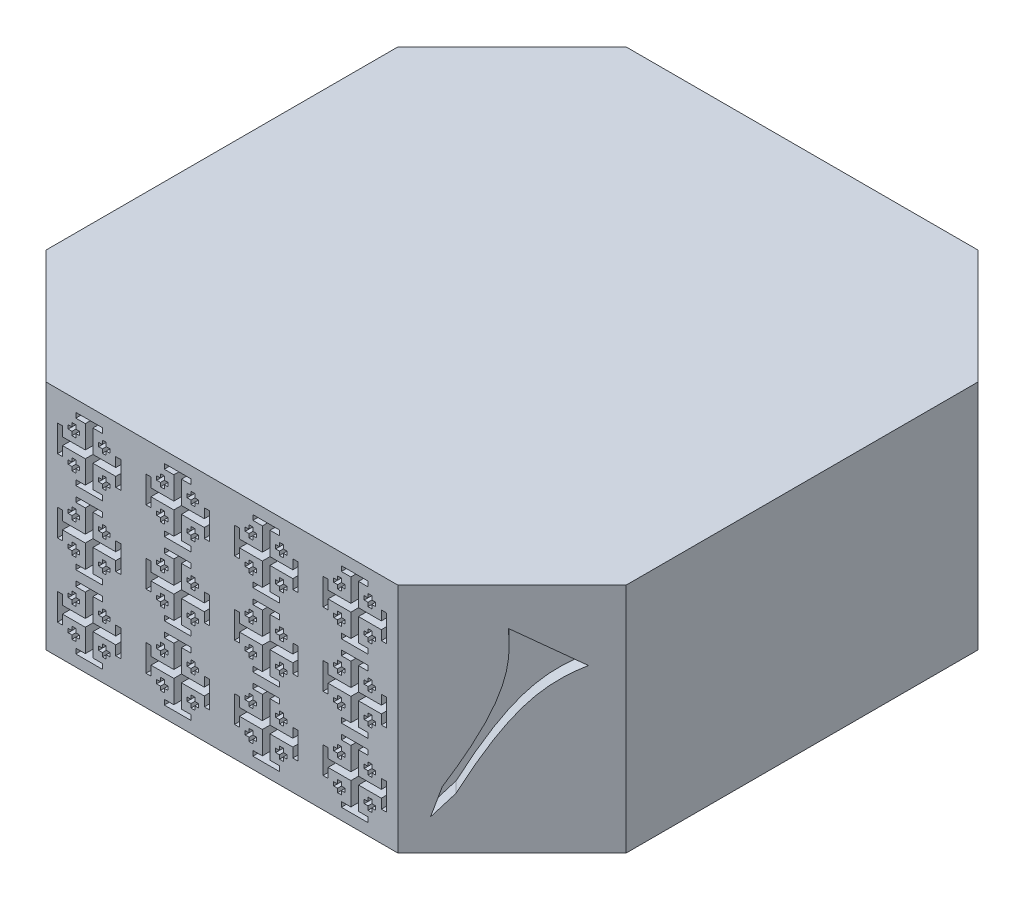
from build123d import *

# Parameters (mm, degrees)
SKETCH1_W           = 38.1
SKETCH1_H           = 38.1
BOSS_EXTRUDE1_DEPTH = 15.24
CUT_EXTRUDE1_DEPTH  = 56.99533552
CUT_EXTRUDE2_DEPTH  = 1
CUT_EXTRUDE3_DEPTH  = 1


with BuildPart() as part:
    # Sketch1 → Boss-Extrude1 (new body)
    with BuildSketch(Plane(origin=(0, 0, 0), x_dir=(1, 0, 0), z_dir=(0, 1, 0))):
        with Locations((19.05, 19.05)):
            Rectangle(SKETCH1_W, SKETCH1_H)
    extrude(amount=BOSS_EXTRUDE1_DEPTH)

    # Sketch2 → Cut-Extrude1 (cut, through all)
    with BuildSketch(Plane(origin=(0, 15.24, 0), x_dir=(1, 0, 0), z_dir=(0, 1, 0))):
        Polygon((30.6, 38.1), (38.1, 30.6), (38.1, 38.1), align=None)
        Polygon((38.1, 0), (38.1, 7.5), (30.6, 0), align=None)
        Polygon((0, 30.6), (7.5, 38.1), (0, 38.1), align=None)
        Polygon((0, 0), (7.5, 0), (0, 7.5), align=None)
    extrude(amount=-CUT_EXTRUDE1_DEPTH, mode=Mode.SUBTRACT)

    # Sketch6 → Cut-Extrude2 (cut)
    with BuildSketch(Plane(origin=(15.3, 0, 15.3), x_dir=(0.7071067811865475, 0, -0.7071067811865477), z_dir=(0.7071067811865477, 0, 0.7071067811865475))):
        with BuildLine():
            Line((24.345514138, 3.403393261), (23.156375891, 2.055676922))
            Line((23.156375891, 2.055676922), (23.701243492, 3.768425706))
            add(Edge.make_bspline(
                [(23.701243492, 3.768425706), (26.718663189, 8.662530398), (26.93497259, 10.625773971), (26.772713928, 12.772598383)],
                knots=[0, 0, 0, 0, 1, 1, 1, 1], degree=3))
            Line((26.772713928, 12.772598383), (30.490582973, 10.666119006))
            add(Edge.make_bspline(
                [(24.345514138, 3.403393261), (26.992755281, 8.507234627), (28.565642017, 9.701865281), (30.490582973, 10.666119006)],
                knots=[0, 0, 0, 0, 1, 1, 1, 1], degree=3))
        make_face()
    extrude(amount=-CUT_EXTRUDE2_DEPTH, mode=Mode.SUBTRACT)

    # Sketch9 → Cut-Extrude3 (cut)
    with BuildSketch(Plane.XY):
        Polygon((9.205, 13.785), (9.205, 13.535), (8.955, 13.535), (8.955, 13.285), (9.205, 13.285), (9.205, 13.035), (9.455, 13.035), (9.455, 13.285), (9.705, 13.285), (9.705, 13.535), (9.455, 13.535), (9.455, 13.785), align=None)
        Polygon((10.33, 14.49), (9.455, 14.49), (9.455, 14.16), (10.08, 14.16), (10.08, 12.66), (8.58, 12.66), (8.58, 13.285), (8.25, 13.285), (8.25, 12.41), (8.25, 11.535), (8.58, 11.535), (8.58, 12.16), (10.08, 12.16), (10.08, 10.66), (9.455, 10.66), (9.455, 10.33), (10.33, 10.33), (11.205, 10.33), (11.205, 10.66), (10.58, 10.66), (10.58, 12.16), (12.08, 12.16), (12.08, 11.535), (12.41, 11.535), (12.41, 12.41), (12.41, 13.285), (12.08, 13.285), (12.08, 12.66), (10.58, 12.66), (10.58, 14.16), (11.205, 14.16), (11.205, 14.49), align=None)
        Polygon((11.705, 13.285), (11.705, 13.535), (11.455, 13.535), (11.455, 13.785), (11.205, 13.785), (11.205, 13.535), (10.955, 13.535), (10.955, 13.285), (11.205, 13.285), (11.205, 13.035), (11.455, 13.035), (11.455, 13.285), align=None)
        Polygon((11.205, 11.035), (11.455, 11.035), (11.455, 11.285), (11.705, 11.285), (11.705, 11.535), (11.455, 11.535), (11.455, 11.785), (11.205, 11.785), (11.205, 11.535), (10.955, 11.535), (10.955, 11.285), (11.205, 11.285), align=None)
        Polygon((8.955, 11.535), (8.955, 11.285), (9.205, 11.285), (9.205, 11.035), (9.455, 11.035), (9.455, 11.285), (9.705, 11.285), (9.705, 11.535), (9.455, 11.535), (9.455, 11.785), (9.205, 11.785), (9.205, 11.535), align=None)
        Polygon((16.143333333, 14.49), (15.268333333, 14.49), (15.268333333, 14.16), (15.893333333, 14.16), (15.893333333, 12.66), (14.393333333, 12.66), (14.393333333, 13.285), (14.063333333, 13.285), (14.063333333, 12.41), (14.063333333, 11.535), (14.393333333, 11.535), (14.393333333, 12.16), (15.893333333, 12.16), (15.893333333, 10.66), (15.268333333, 10.66), (15.268333333, 10.33), (16.143333333, 10.33), (17.018333333, 10.33), (17.018333333, 10.66), (16.393333333, 10.66), (16.393333333, 12.16), (17.893333333, 12.16), (17.893333333, 11.535), (18.223333333, 11.535), (18.223333333, 12.41), (18.223333333, 13.285), (17.893333333, 13.285), (17.893333333, 12.66), (16.393333333, 12.66), (16.393333333, 14.16), (17.018333333, 14.16), (17.018333333, 14.49), align=None)
        Polygon((15.268333333, 13.785), (15.018333333, 13.785), (15.018333333, 13.535), (14.768333333, 13.535), (14.768333333, 13.285), (15.018333333, 13.285), (15.018333333, 13.035), (15.268333333, 13.035), (15.268333333, 13.285), (15.518333333, 13.285), (15.518333333, 13.535), (15.268333333, 13.535), align=None)
        Polygon((14.768333333, 11.535), (14.768333333, 11.285), (15.018333333, 11.285), (15.018333333, 11.035), (15.268333333, 11.035), (15.268333333, 11.285), (15.518333333, 11.285), (15.518333333, 11.535), (15.268333333, 11.535), (15.268333333, 11.785), (15.018333333, 11.785), (15.018333333, 11.535), align=None)
        Polygon((17.018333333, 11.035), (17.268333333, 11.035), (17.268333333, 11.285), (17.518333333, 11.285), (17.518333333, 11.535), (17.268333333, 11.535), (17.268333333, 11.785), (17.018333333, 11.785), (17.018333333, 11.535), (16.768333333, 11.535), (16.768333333, 11.285), (17.018333333, 11.285), align=None)
        Polygon((17.518333333, 13.285), (17.518333333, 13.535), (17.268333333, 13.535), (17.268333333, 13.785), (17.018333333, 13.785), (17.018333333, 13.535), (16.768333333, 13.535), (16.768333333, 13.285), (17.018333333, 13.285), (17.018333333, 13.035), (17.268333333, 13.035), (17.268333333, 13.285), align=None)
        Polygon((21.956666667, 14.49), (21.081666667, 14.49), (21.081666667, 14.16), (21.706666667, 14.16), (21.706666667, 12.66), (20.206666667, 12.66), (20.206666667, 13.285), (19.876666667, 13.285), (19.876666667, 12.41), (19.876666667, 11.535), (20.206666667, 11.535), (20.206666667, 12.16), (21.706666667, 12.16), (21.706666667, 10.66), (21.081666667, 10.66), (21.081666667, 10.33), (21.956666667, 10.33), (22.831666667, 10.33), (22.831666667, 10.66), (22.206666667, 10.66), (22.206666667, 12.16), (23.706666667, 12.16), (23.706666667, 11.535), (24.036666667, 11.535), (24.036666667, 12.41), (24.036666667, 13.285), (23.706666667, 13.285), (23.706666667, 12.66), (22.206666667, 12.66), (22.206666667, 14.16), (22.831666667, 14.16), (22.831666667, 14.49), align=None)
        Polygon((21.081666667, 13.785), (20.831666667, 13.785), (20.831666667, 13.535), (20.581666667, 13.535), (20.581666667, 13.285), (20.831666667, 13.285), (20.831666667, 13.035), (21.081666667, 13.035), (21.081666667, 13.285), (21.331666667, 13.285), (21.331666667, 13.535), (21.081666667, 13.535), align=None)
        Polygon((20.581666667, 11.535), (20.581666667, 11.285), (20.831666667, 11.285), (20.831666667, 11.035), (21.081666667, 11.035), (21.081666667, 11.285), (21.331666667, 11.285), (21.331666667, 11.535), (21.081666667, 11.535), (21.081666667, 11.785), (20.831666667, 11.785), (20.831666667, 11.535), align=None)
        Polygon((22.831666667, 11.035), (23.081666667, 11.035), (23.081666667, 11.285), (23.331666667, 11.285), (23.331666667, 11.535), (23.081666667, 11.535), (23.081666667, 11.785), (22.831666667, 11.785), (22.831666667, 11.535), (22.581666667, 11.535), (22.581666667, 11.285), (22.831666667, 11.285), align=None)
        Polygon((23.331666667, 13.285), (23.331666667, 13.535), (23.081666667, 13.535), (23.081666667, 13.785), (22.831666667, 13.785), (22.831666667, 13.535), (22.581666667, 13.535), (22.581666667, 13.285), (22.831666667, 13.285), (22.831666667, 13.035), (23.081666667, 13.035), (23.081666667, 13.285), align=None)
        Polygon((27.77, 14.49), (26.895, 14.49), (26.895, 14.16), (27.52, 14.16), (27.52, 12.66), (26.02, 12.66), (26.02, 13.285), (25.69, 13.285), (25.69, 12.41), (25.69, 11.535), (26.02, 11.535), (26.02, 12.16), (27.52, 12.16), (27.52, 10.66), (26.895, 10.66), (26.895, 10.33), (27.77, 10.33), (28.645, 10.33), (28.645, 10.66), (28.02, 10.66), (28.02, 12.16), (29.52, 12.16), (29.52, 11.535), (29.85, 11.535), (29.85, 12.41), (29.85, 13.285), (29.52, 13.285), (29.52, 12.66), (28.02, 12.66), (28.02, 14.16), (28.645, 14.16), (28.645, 14.49), align=None)
        Polygon((26.895, 13.785), (26.645, 13.785), (26.645, 13.535), (26.395, 13.535), (26.395, 13.285), (26.645, 13.285), (26.645, 13.035), (26.895, 13.035), (26.895, 13.285), (27.145, 13.285), (27.145, 13.535), (26.895, 13.535), align=None)
        Polygon((26.395, 11.535), (26.395, 11.285), (26.645, 11.285), (26.645, 11.035), (26.895, 11.035), (26.895, 11.285), (27.145, 11.285), (27.145, 11.535), (26.895, 11.535), (26.895, 11.785), (26.645, 11.785), (26.645, 11.535), align=None)
        Polygon((28.645, 11.035), (28.895, 11.035), (28.895, 11.285), (29.145, 11.285), (29.145, 11.535), (28.895, 11.535), (28.895, 11.785), (28.645, 11.785), (28.645, 11.535), (28.395, 11.535), (28.395, 11.285), (28.645, 11.285), align=None)
        Polygon((29.145, 13.285), (29.145, 13.535), (28.895, 13.535), (28.895, 13.785), (28.645, 13.785), (28.645, 13.535), (28.395, 13.535), (28.395, 13.285), (28.645, 13.285), (28.645, 13.035), (28.895, 13.035), (28.895, 13.285), align=None)
        Polygon((16.143333333, 9.7), (15.268333333, 9.7), (15.268333333, 9.37), (15.893333333, 9.37), (15.893333333, 7.87), (14.393333333, 7.87), (14.393333333, 8.495), (14.063333333, 8.495), (14.063333333, 7.62), (14.063333333, 6.745), (14.393333333, 6.745), (14.393333333, 7.37), (15.893333333, 7.37), (15.893333333, 5.87), (15.268333333, 5.87), (15.268333333, 5.54), (16.143333333, 5.54), (17.018333333, 5.54), (17.018333333, 5.87), (16.393333333, 5.87), (16.393333333, 7.37), (17.893333333, 7.37), (17.893333333, 6.745), (18.223333333, 6.745), (18.223333333, 7.62), (18.223333333, 8.495), (17.893333333, 8.495), (17.893333333, 7.87), (16.393333333, 7.87), (16.393333333, 9.37), (17.018333333, 9.37), (17.018333333, 9.7), align=None)
        Polygon((15.268333333, 8.995), (15.018333333, 8.995), (15.018333333, 8.745), (14.768333333, 8.745), (14.768333333, 8.495), (15.018333333, 8.495), (15.018333333, 8.245), (15.268333333, 8.245), (15.268333333, 8.495), (15.518333333, 8.495), (15.518333333, 8.745), (15.268333333, 8.745), align=None)
        Polygon((14.768333333, 6.745), (14.768333333, 6.495), (15.018333333, 6.495), (15.018333333, 6.245), (15.268333333, 6.245), (15.268333333, 6.495), (15.518333333, 6.495), (15.518333333, 6.745), (15.268333333, 6.745), (15.268333333, 6.995), (15.018333333, 6.995), (15.018333333, 6.745), align=None)
        Polygon((17.018333333, 6.245), (17.268333333, 6.245), (17.268333333, 6.495), (17.518333333, 6.495), (17.518333333, 6.745), (17.268333333, 6.745), (17.268333333, 6.995), (17.018333333, 6.995), (17.018333333, 6.745), (16.768333333, 6.745), (16.768333333, 6.495), (17.018333333, 6.495), align=None)
        Polygon((17.518333333, 8.495), (17.518333333, 8.745), (17.268333333, 8.745), (17.268333333, 8.995), (17.018333333, 8.995), (17.018333333, 8.745), (16.768333333, 8.745), (16.768333333, 8.495), (17.018333333, 8.495), (17.018333333, 8.245), (17.268333333, 8.245), (17.268333333, 8.495), align=None)
        Polygon((21.956666667, 9.7), (21.081666667, 9.7), (21.081666667, 9.37), (21.706666667, 9.37), (21.706666667, 7.87), (20.206666667, 7.87), (20.206666667, 8.495), (19.876666667, 8.495), (19.876666667, 7.62), (19.876666667, 6.745), (20.206666667, 6.745), (20.206666667, 7.37), (21.706666667, 7.37), (21.706666667, 5.87), (21.081666667, 5.87), (21.081666667, 5.54), (21.956666667, 5.54), (22.831666667, 5.54), (22.831666667, 5.87), (22.206666667, 5.87), (22.206666667, 7.37), (23.706666667, 7.37), (23.706666667, 6.745), (24.036666667, 6.745), (24.036666667, 7.62), (24.036666667, 8.495), (23.706666667, 8.495), (23.706666667, 7.87), (22.206666667, 7.87), (22.206666667, 9.37), (22.831666667, 9.37), (22.831666667, 9.7), align=None)
        Polygon((21.081666667, 8.995), (20.831666667, 8.995), (20.831666667, 8.745), (20.581666667, 8.745), (20.581666667, 8.495), (20.831666667, 8.495), (20.831666667, 8.245), (21.081666667, 8.245), (21.081666667, 8.495), (21.331666667, 8.495), (21.331666667, 8.745), (21.081666667, 8.745), align=None)
        Polygon((20.581666667, 6.745), (20.581666667, 6.495), (20.831666667, 6.495), (20.831666667, 6.245), (21.081666667, 6.245), (21.081666667, 6.495), (21.331666667, 6.495), (21.331666667, 6.745), (21.081666667, 6.745), (21.081666667, 6.995), (20.831666667, 6.995), (20.831666667, 6.745), align=None)
        Polygon((22.831666667, 6.245), (23.081666667, 6.245), (23.081666667, 6.495), (23.331666667, 6.495), (23.331666667, 6.745), (23.081666667, 6.745), (23.081666667, 6.995), (22.831666667, 6.995), (22.831666667, 6.745), (22.581666667, 6.745), (22.581666667, 6.495), (22.831666667, 6.495), align=None)
        Polygon((23.331666667, 8.495), (23.331666667, 8.745), (23.081666667, 8.745), (23.081666667, 8.995), (22.831666667, 8.995), (22.831666667, 8.745), (22.581666667, 8.745), (22.581666667, 8.495), (22.831666667, 8.495), (22.831666667, 8.245), (23.081666667, 8.245), (23.081666667, 8.495), align=None)
        Polygon((27.77, 9.7), (26.895, 9.7), (26.895, 9.37), (27.52, 9.37), (27.52, 7.87), (26.02, 7.87), (26.02, 8.495), (25.69, 8.495), (25.69, 7.62), (25.69, 6.745), (26.02, 6.745), (26.02, 7.37), (27.52, 7.37), (27.52, 5.87), (26.895, 5.87), (26.895, 5.54), (27.77, 5.54), (28.645, 5.54), (28.645, 5.87), (28.02, 5.87), (28.02, 7.37), (29.52, 7.37), (29.52, 6.745), (29.85, 6.745), (29.85, 7.62), (29.85, 8.495), (29.52, 8.495), (29.52, 7.87), (28.02, 7.87), (28.02, 9.37), (28.645, 9.37), (28.645, 9.7), align=None)
        Polygon((26.895, 8.995), (26.645, 8.995), (26.645, 8.745), (26.395, 8.745), (26.395, 8.495), (26.645, 8.495), (26.645, 8.245), (26.895, 8.245), (26.895, 8.495), (27.145, 8.495), (27.145, 8.745), (26.895, 8.745), align=None)
        Polygon((26.395, 6.745), (26.395, 6.495), (26.645, 6.495), (26.645, 6.245), (26.895, 6.245), (26.895, 6.495), (27.145, 6.495), (27.145, 6.745), (26.895, 6.745), (26.895, 6.995), (26.645, 6.995), (26.645, 6.745), align=None)
        Polygon((28.645, 6.245), (28.895, 6.245), (28.895, 6.495), (29.145, 6.495), (29.145, 6.745), (28.895, 6.745), (28.895, 6.995), (28.645, 6.995), (28.645, 6.745), (28.395, 6.745), (28.395, 6.495), (28.645, 6.495), align=None)
        Polygon((29.145, 8.495), (29.145, 8.745), (28.895, 8.745), (28.895, 8.995), (28.645, 8.995), (28.645, 8.745), (28.395, 8.745), (28.395, 8.495), (28.645, 8.495), (28.645, 8.245), (28.895, 8.245), (28.895, 8.495), align=None)
        Polygon((16.143333333, 4.91), (15.268333333, 4.91), (15.268333333, 4.58), (15.893333333, 4.58), (15.893333333, 3.08), (14.393333333, 3.08), (14.393333333, 3.705), (14.063333333, 3.705), (14.063333333, 2.83), (14.063333333, 1.955), (14.393333333, 1.955), (14.393333333, 2.58), (15.893333333, 2.58), (15.893333333, 1.08), (15.268333333, 1.08), (15.268333333, 0.75), (16.143333333, 0.75), (17.018333333, 0.75), (17.018333333, 1.08), (16.393333333, 1.08), (16.393333333, 2.58), (17.893333333, 2.58), (17.893333333, 1.955), (18.223333333, 1.955), (18.223333333, 2.83), (18.223333333, 3.705), (17.893333333, 3.705), (17.893333333, 3.08), (16.393333333, 3.08), (16.393333333, 4.58), (17.018333333, 4.58), (17.018333333, 4.91), align=None)
        Polygon((15.268333333, 4.205), (15.018333333, 4.205), (15.018333333, 3.955), (14.768333333, 3.955), (14.768333333, 3.705), (15.018333333, 3.705), (15.018333333, 3.455), (15.268333333, 3.455), (15.268333333, 3.705), (15.518333333, 3.705), (15.518333333, 3.955), (15.268333333, 3.955), align=None)
        Polygon((14.768333333, 1.955), (14.768333333, 1.705), (15.018333333, 1.705), (15.018333333, 1.455), (15.268333333, 1.455), (15.268333333, 1.705), (15.518333333, 1.705), (15.518333333, 1.955), (15.268333333, 1.955), (15.268333333, 2.205), (15.018333333, 2.205), (15.018333333, 1.955), align=None)
        Polygon((17.018333333, 1.455), (17.268333333, 1.455), (17.268333333, 1.705), (17.518333333, 1.705), (17.518333333, 1.955), (17.268333333, 1.955), (17.268333333, 2.205), (17.018333333, 2.205), (17.018333333, 1.955), (16.768333333, 1.955), (16.768333333, 1.705), (17.018333333, 1.705), align=None)
        Polygon((17.518333333, 3.705), (17.518333333, 3.955), (17.268333333, 3.955), (17.268333333, 4.205), (17.018333333, 4.205), (17.018333333, 3.955), (16.768333333, 3.955), (16.768333333, 3.705), (17.018333333, 3.705), (17.018333333, 3.455), (17.268333333, 3.455), (17.268333333, 3.705), align=None)
        Polygon((21.956666667, 4.91), (21.081666667, 4.91), (21.081666667, 4.58), (21.706666667, 4.58), (21.706666667, 3.08), (20.206666667, 3.08), (20.206666667, 3.705), (19.876666667, 3.705), (19.876666667, 2.83), (19.876666667, 1.955), (20.206666667, 1.955), (20.206666667, 2.58), (21.706666667, 2.58), (21.706666667, 1.08), (21.081666667, 1.08), (21.081666667, 0.75), (21.956666667, 0.75), (22.831666667, 0.75), (22.831666667, 1.08), (22.206666667, 1.08), (22.206666667, 2.58), (23.706666667, 2.58), (23.706666667, 1.955), (24.036666667, 1.955), (24.036666667, 2.83), (24.036666667, 3.705), (23.706666667, 3.705), (23.706666667, 3.08), (22.206666667, 3.08), (22.206666667, 4.58), (22.831666667, 4.58), (22.831666667, 4.91), align=None)
        Polygon((21.081666667, 4.205), (20.831666667, 4.205), (20.831666667, 3.955), (20.581666667, 3.955), (20.581666667, 3.705), (20.831666667, 3.705), (20.831666667, 3.455), (21.081666667, 3.455), (21.081666667, 3.705), (21.331666667, 3.705), (21.331666667, 3.955), (21.081666667, 3.955), align=None)
        Polygon((20.581666667, 1.955), (20.581666667, 1.705), (20.831666667, 1.705), (20.831666667, 1.455), (21.081666667, 1.455), (21.081666667, 1.705), (21.331666667, 1.705), (21.331666667, 1.955), (21.081666667, 1.955), (21.081666667, 2.205), (20.831666667, 2.205), (20.831666667, 1.955), align=None)
        Polygon((22.831666667, 1.455), (23.081666667, 1.455), (23.081666667, 1.705), (23.331666667, 1.705), (23.331666667, 1.955), (23.081666667, 1.955), (23.081666667, 2.205), (22.831666667, 2.205), (22.831666667, 1.955), (22.581666667, 1.955), (22.581666667, 1.705), (22.831666667, 1.705), align=None)
        Polygon((23.331666667, 3.705), (23.331666667, 3.955), (23.081666667, 3.955), (23.081666667, 4.205), (22.831666667, 4.205), (22.831666667, 3.955), (22.581666667, 3.955), (22.581666667, 3.705), (22.831666667, 3.705), (22.831666667, 3.455), (23.081666667, 3.455), (23.081666667, 3.705), align=None)
        Polygon((27.77, 4.91), (26.895, 4.91), (26.895, 4.58), (27.52, 4.58), (27.52, 3.08), (26.02, 3.08), (26.02, 3.705), (25.69, 3.705), (25.69, 2.83), (25.69, 1.955), (26.02, 1.955), (26.02, 2.58), (27.52, 2.58), (27.52, 1.08), (26.895, 1.08), (26.895, 0.75), (27.77, 0.75), (28.645, 0.75), (28.645, 1.08), (28.02, 1.08), (28.02, 2.58), (29.52, 2.58), (29.52, 1.955), (29.85, 1.955), (29.85, 2.83), (29.85, 3.705), (29.52, 3.705), (29.52, 3.08), (28.02, 3.08), (28.02, 4.58), (28.645, 4.58), (28.645, 4.91), align=None)
        Polygon((26.895, 4.205), (26.645, 4.205), (26.645, 3.955), (26.395, 3.955), (26.395, 3.705), (26.645, 3.705), (26.645, 3.455), (26.895, 3.455), (26.895, 3.705), (27.145, 3.705), (27.145, 3.955), (26.895, 3.955), align=None)
        Polygon((26.395, 1.955), (26.395, 1.705), (26.645, 1.705), (26.645, 1.455), (26.895, 1.455), (26.895, 1.705), (27.145, 1.705), (27.145, 1.955), (26.895, 1.955), (26.895, 2.205), (26.645, 2.205), (26.645, 1.955), align=None)
        Polygon((28.645, 1.455), (28.895, 1.455), (28.895, 1.705), (29.145, 1.705), (29.145, 1.955), (28.895, 1.955), (28.895, 2.205), (28.645, 2.205), (28.645, 1.955), (28.395, 1.955), (28.395, 1.705), (28.645, 1.705), align=None)
        Polygon((29.145, 3.705), (29.145, 3.955), (28.895, 3.955), (28.895, 4.205), (28.645, 4.205), (28.645, 3.955), (28.395, 3.955), (28.395, 3.705), (28.645, 3.705), (28.645, 3.455), (28.895, 3.455), (28.895, 3.705), align=None)
        Polygon((10.33, 9.7), (9.455, 9.7), (9.455, 9.37), (10.08, 9.37), (10.08, 7.87), (8.58, 7.87), (8.58, 8.495), (8.25, 8.495), (8.25, 7.62), (8.25, 6.745), (8.58, 6.745), (8.58, 7.37), (10.08, 7.37), (10.08, 5.87), (9.455, 5.87), (9.455, 5.54), (10.33, 5.54), (11.205, 5.54), (11.205, 5.87), (10.58, 5.87), (10.58, 7.37), (12.08, 7.37), (12.08, 6.745), (12.41, 6.745), (12.41, 7.62), (12.41, 8.495), (12.08, 8.495), (12.08, 7.87), (10.58, 7.87), (10.58, 9.37), (11.205, 9.37), (11.205, 9.7), align=None)
        Polygon((9.455, 8.995), (9.205, 8.995), (9.205, 8.745), (8.955, 8.745), (8.955, 8.495), (9.205, 8.495), (9.205, 8.245), (9.455, 8.245), (9.455, 8.495), (9.705, 8.495), (9.705, 8.745), (9.455, 8.745), align=None)
        Polygon((8.955, 6.745), (8.955, 6.495), (9.205, 6.495), (9.205, 6.245), (9.455, 6.245), (9.455, 6.495), (9.705, 6.495), (9.705, 6.745), (9.455, 6.745), (9.455, 6.995), (9.205, 6.995), (9.205, 6.745), align=None)
        Polygon((11.205, 6.245), (11.455, 6.245), (11.455, 6.495), (11.705, 6.495), (11.705, 6.745), (11.455, 6.745), (11.455, 6.995), (11.205, 6.995), (11.205, 6.745), (10.955, 6.745), (10.955, 6.495), (11.205, 6.495), align=None)
        Polygon((11.705, 8.495), (11.705, 8.745), (11.455, 8.745), (11.455, 8.995), (11.205, 8.995), (11.205, 8.745), (10.955, 8.745), (10.955, 8.495), (11.205, 8.495), (11.205, 8.245), (11.455, 8.245), (11.455, 8.495), align=None)
        Polygon((10.33, 4.91), (9.455, 4.91), (9.455, 4.58), (10.08, 4.58), (10.08, 3.08), (8.58, 3.08), (8.58, 3.705), (8.25, 3.705), (8.25, 2.83), (8.25, 1.955), (8.58, 1.955), (8.58, 2.58), (10.08, 2.58), (10.08, 1.08), (9.455, 1.08), (9.455, 0.75), (10.33, 0.75), (11.205, 0.75), (11.205, 1.08), (10.58, 1.08), (10.58, 2.58), (12.08, 2.58), (12.08, 1.955), (12.41, 1.955), (12.41, 2.83), (12.41, 3.705), (12.08, 3.705), (12.08, 3.08), (10.58, 3.08), (10.58, 4.58), (11.205, 4.58), (11.205, 4.91), align=None)
        Polygon((9.455, 4.205), (9.205, 4.205), (9.205, 3.955), (8.955, 3.955), (8.955, 3.705), (9.205, 3.705), (9.205, 3.455), (9.455, 3.455), (9.455, 3.705), (9.705, 3.705), (9.705, 3.955), (9.455, 3.955), align=None)
        Polygon((8.955, 1.955), (8.955, 1.705), (9.205, 1.705), (9.205, 1.455), (9.455, 1.455), (9.455, 1.705), (9.705, 1.705), (9.705, 1.955), (9.455, 1.955), (9.455, 2.205), (9.205, 2.205), (9.205, 1.955), align=None)
        Polygon((11.205, 1.455), (11.455, 1.455), (11.455, 1.705), (11.705, 1.705), (11.705, 1.955), (11.455, 1.955), (11.455, 2.205), (11.205, 2.205), (11.205, 1.955), (10.955, 1.955), (10.955, 1.705), (11.205, 1.705), align=None)
        Polygon((11.705, 3.705), (11.705, 3.955), (11.455, 3.955), (11.455, 4.205), (11.205, 4.205), (11.205, 3.955), (10.955, 3.955), (10.955, 3.705), (11.205, 3.705), (11.205, 3.455), (11.455, 3.455), (11.455, 3.705), align=None)
    cut_extrude3 = extrude(amount=-CUT_EXTRUDE3_DEPTH, mode=Mode.SUBTRACT)

    # Mirror1: Cut-Extrude3 across plane
    add(cut_extrude3.mirror(Plane.XY.offset(-19.05)), mode=Mode.SUBTRACT)


solid = part.part
